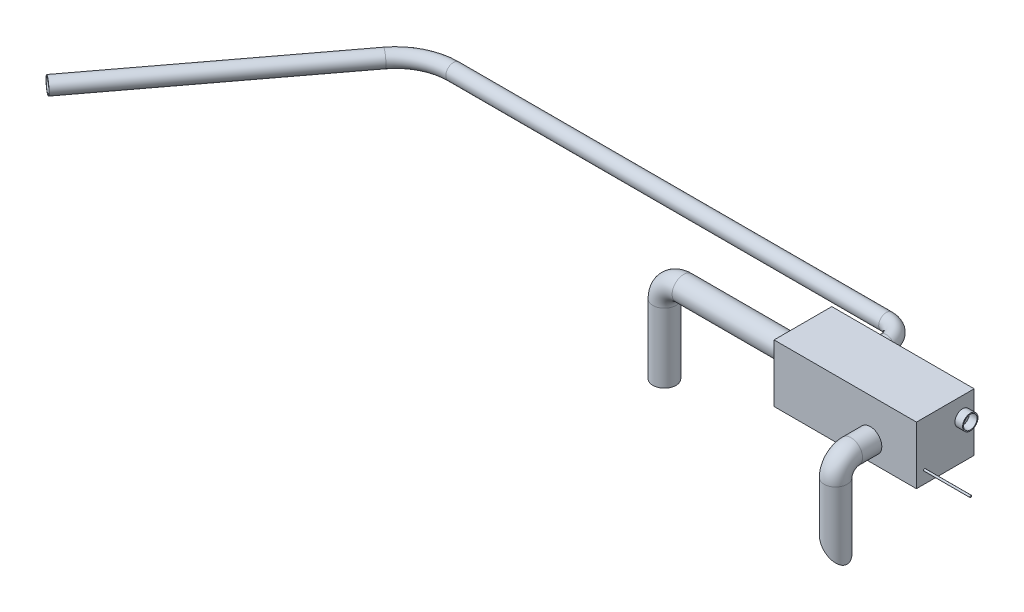
from build123d import *

# Parameters (mm, degrees)
SKETCH1_W           = 939.8
SKETCH1_H           = 381
BOSS_EXTRUDE1_DEPTH = 381
SKETCH2_R           = 76.2
SKETCH2_R_2         = 69.85
BOSS_EXTRUDE2_DEPTH = 101.6
SKETCH3_R           = 50.8
SKETCH3_R_2         = 44.45
BOSS_EXTRUDE3_DEPTH = 50.8
SKETCH4_R           = 6.35
BOSS_EXTRUDE4_DEPTH = 304.8
SKETCH5_R           = 50.8
SKETCH5_R_2         = 44.45
BOSS_EXTRUDE5_DEPTH = 50.8
SKETCH6_R           = 76.2
SKETCH6_R_2         = 69.85
BOSS_EXTRUDE6_DEPTH = 762
SKETCH7_R           = 76.2
SKETCH7_R_2         = 69.85
CUT_EXTRUDE3_DEPTH  = 1375.947304445
SKETCH27_R          = 76.2
SKETCH27_R_2        = 69.85
SKETCH29_R          = 50.8
SKETCH29_R_2        = 44.45


with BuildPart() as part:
    # Sketch1 → Boss-Extrude1 (new body)
    with BuildSketch(Plane(origin=(0, 0, 0), x_dir=(1, 0, 0), z_dir=(0, 1, 0))):
        Rectangle(SKETCH1_W, SKETCH1_H)
    extrude(amount=BOSS_EXTRUDE1_DEPTH)

    # Sketch2 → Boss-Extrude2 (add)
    with BuildSketch(Plane.XY.offset(190.5)):
        with Locations((165.1, 127)):
            Circle(SKETCH2_R)
        with Locations((165.1, 127)):
            Circle(SKETCH2_R_2, mode=Mode.SUBTRACT)
    extrude(amount=BOSS_EXTRUDE2_DEPTH)

    # Sketch3 → Boss-Extrude3 (add)
    with BuildSketch(Plane(origin=(469.9, 0, 0), x_dir=(0, 0, -1), z_dir=(1, 0, 0))):
        with Locations((114.3, 254)):
            Circle(SKETCH3_R)
        with Locations((114.3, 254)):
            Circle(SKETCH3_R_2, mode=Mode.SUBTRACT)
    extrude(amount=BOSS_EXTRUDE3_DEPTH)

    # Sketch4 → Boss-Extrude4 (add)
    with BuildSketch(Plane(origin=(469.9, 0, 0), x_dir=(0, 0, -1), z_dir=(1, 0, 0))):
        with Locations((-136.850125002, 81.35113945)):
            Circle(SKETCH4_R)
    extrude(amount=BOSS_EXTRUDE4_DEPTH)

    # Sketch5 → Boss-Extrude5 (add)
    with BuildSketch(Plane(origin=(0, 0, -190.5), x_dir=(-1, 0, 0), z_dir=(0, 0, -1))):
        with Locations((185.69264526, 273.888159849)):
            Circle(SKETCH5_R)
        with Locations((185.69264526, 273.888159849)):
            Circle(SKETCH5_R_2, mode=Mode.SUBTRACT)
    extrude(amount=BOSS_EXTRUDE5_DEPTH)

    # Sketch6 → Boss-Extrude6 (add)
    with BuildSketch(Plane.ZY.offset(469.9)):
        with Locations((0, 190.5)):
            Circle(SKETCH6_R)
        with Locations((0, 190.5)):
            Circle(SKETCH6_R_2, mode=Mode.SUBTRACT)
    extrude(amount=BOSS_EXTRUDE6_DEPTH)

    # Sweep1: sweep along a path in Sketch8
    with BuildLine(Plane(origin=(165.1, 0, 0), x_dir=(0, 0, -1), z_dir=(1, 0, 0))) as sweep1_path:
        Line((-292.1, 127), (-317.5, 127))
        ThreePointArc((-317.5, 127), (-389.342048969, 97.242048969), (-419.1, 25.4))
        Line((-419.1, 25.4), (-419.1, -431.8))
    # Sketch7 → Sweep1 (sweep)
    with BuildSketch(Plane.XY.offset(292.1)):
        with Locations((165.1, 127)):
            Circle(SKETCH7_R)
        with Locations((165.1, 127)):
            Circle(SKETCH7_R_2, mode=Mode.SUBTRACT)
    sweep(path=sweep1_path.line)

    # Sketch22 → Cut-Extrude3 (cut, through all)
    with BuildSketch(Plane.XY.offset(190.5)):
        Polygon((88.9, -279.4), (241.3, -431.8), (88.9, -431.8), align=None)
    extrude(amount=CUT_EXTRUDE3_DEPTH, mode=Mode.SUBTRACT)

    # Sweep8: sweep along a path in Sketch26
    with BuildLine(Plane.XY) as sweep8_path:
        Line((-1231.9, 190.5), (-1257.3, 190.5))
        ThreePointArc((-1257.3, 190.5), (-1347.102561211, 153.302561211), (-1384.3, 63.5))
        Line((-1384.3, 63.5), (-1384.3, -393.7))
    # Sketch27 → Sweep8 (sweep)
    with BuildSketch(Plane.ZY.offset(1231.9)):
        with Locations((0, 190.5)):
            Circle(SKETCH27_R)
        with Locations((0, 190.5)):
            Circle(SKETCH27_R_2, mode=Mode.SUBTRACT)
    sweep(path=sweep8_path.line)

    # Sweep9: sweep along a path in Sketch28
    with BuildLine(Plane(origin=(0, 273.888159849, 0), x_dir=(1, 0, 0), z_dir=(0, 1, 0))) as sweep9_path:
        Line((-185.69264526, 241.3), (-185.69264526, 266.7))
        ThreePointArc((-185.69264526, 266.7), (-222.890084049, 356.502561211), (-312.69264526, 393.7))
        Line((-312.69264526, 393.7), (-3170.733052592, 393.7))
        ThreePointArc((-3170.733052592, 393.7), (-3340.734419386, 353.66999177), (-3475.01318192, 241.991523821))
        Line((-3475.01318192, 241.991523821), (-4430.719756424, -1026.273936864))
    # Sketch29 → Sweep9 (sweep)
    with BuildSketch(Plane(origin=(0, 0, -241.3), x_dir=(-1, 0, 0), z_dir=(0, 0, -1))):
        with Locations((185.69264526, 273.888159849)):
            Circle(SKETCH29_R)
        with Locations((185.69264526, 273.888159849)):
            Circle(SKETCH29_R_2, mode=Mode.SUBTRACT)
    sweep(path=sweep9_path.line)


solid = part.part
